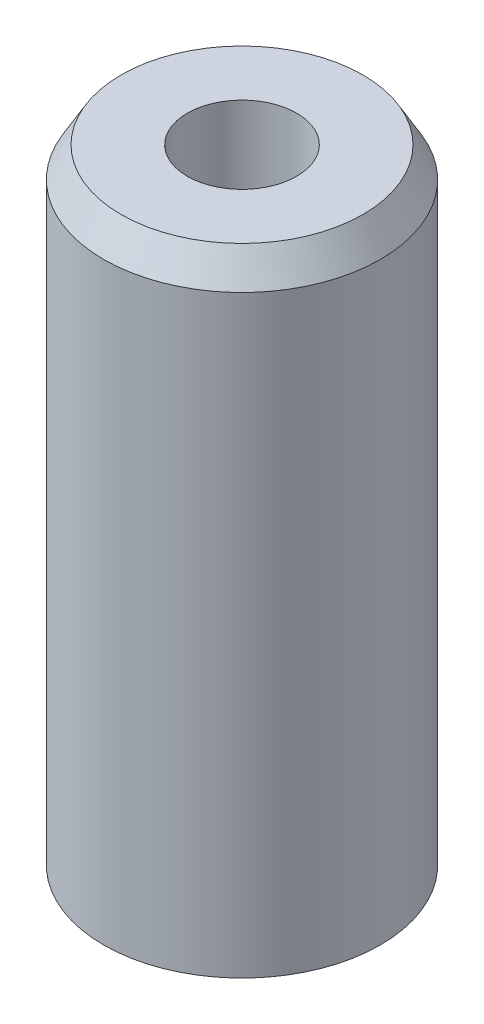
from build123d import *
from OCP.BRepFilletAPI import BRepFilletAPI_MakeChamfer

# Parameters (mm, degrees)
SKETCH1_R           = 5
BOSS_EXTRUDE1_DEPTH = 23.179603195
SKETCH2_R           = 1.977104771
CUT_EXTRUDE1_DEPTH  = 25.234149547
CHAMFER1_SIZE       = 1.090644435
CHAMFER1_SIZE2      = 0.629683858


with BuildPart() as part:
    # Sketch1 → Boss-Extrude1 (new body)
    with BuildSketch(Plane(origin=(0, 0, 0), x_dir=(1, 0, 0), z_dir=(0, 1, 0))):
        Circle(SKETCH1_R)
    extrude(amount=BOSS_EXTRUDE1_DEPTH)

    # Sketch2 → Cut-Extrude1 (cut, through all)
    with BuildSketch(Plane(origin=(0, 0, 0), x_dir=(1, 0, 0), z_dir=(0, 1, 0))):
        Circle(SKETCH2_R)
    extrude(amount=CUT_EXTRUDE1_DEPTH, mode=Mode.SUBTRACT)

    # Chamfer1: one chamfer whose edges measure the first distance from different faces: ONE call of the kernel's chamfer builder (chamfer() names one face for all edges)
    chamfer1_edges_1 = [part.edges().sort_by_distance(p)[0] for p in [
        (-5, 23.179603195, 0),
    ]]
    chamfer1_side_1 = [part.faces().sort_by_distance(p)[0] for p in [
        (-5, 11.589801598, 0),
    ]]
    chamfer1_edges_2 = [part.edges().sort_by_distance(p)[0] for p in [
        (-5, 0, 0),
    ]]
    chamfer1_side_2 = [part.faces().sort_by_distance(p)[0] for p in [
        (-4.858578644, 0, 0),
    ]]
    chamfer1 = BRepFilletAPI_MakeChamfer(part.part.solid().wrapped)
    for e in chamfer1_edges_1:
        chamfer1.Add(CHAMFER1_SIZE, CHAMFER1_SIZE2, e.wrapped, chamfer1_side_1[0].wrapped)  # the first distance lies on this face
    for e in chamfer1_edges_2:
        chamfer1.Add(CHAMFER1_SIZE, CHAMFER1_SIZE2, e.wrapped, chamfer1_side_2[0].wrapped)  # the first distance lies on this face
    add(Compound.cast(chamfer1.Shape()), mode=Mode.REPLACE)


solid = part.part
